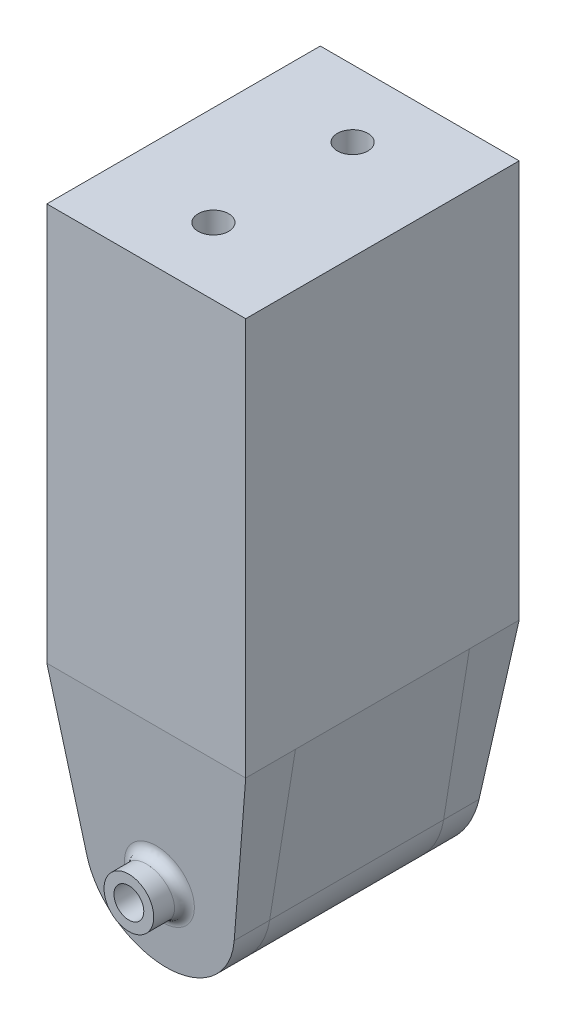
from build123d import *

# Parameters (mm, degrees)
CROQUIS1_W                          = 40
CROQUIS1_H                          = 55
SALIENTE_EXTRUIR1_DEPTH             = 80
CROQUIS2_R                          = 3.075
CORTAR_EXTRUIR2_DEPTH               = 87.926693254
SALIENTE_EXTRUIR2_REACH             = 88.927
SALIENTE_EXTRUIR2_DIRECTION_2_REACH = 88.927
CORTAR_EXTRUIR6_DEPTH               = 87.926693254
CORTAR_EXTRUIR6_DEPTH_BACK          = 87.926693254
CROQUIS6_R                          = 3
CORTAR_EXTRUIR10_DEPTH              = 10
CROQUIS11_R                         = 3
SALIENTE_EXTRUIR3_DEPTH             = 10
CORTAR_EXTRUIR11_DEPTH              = 87.926693254
CORTAR_EXTRUIR11_DEPTH_BACK         = 87.926693254
CORTAR_EXTRUIR15_START              = -10
CORTAR_EXTRUIR15_DEPTH              = 10
CROQUIS17_R                         = 3
SALIENTE_EXTRUIR4_DEPTH             = 10
CORTAR_EXTRUIR16_DEPTH              = 87.926693254
CORTAR_EXTRUIR16_DEPTH_BACK         = 87.926693254
CROQUIS21_R                         = 5
CROQUIS21_R_2                       = 3
SALIENTE_EXTRUIR5_DEPTH             = 3.5
SALIENTE_EXTRUIR5_DIRECTION_2_REACH = 101.121
REDONDEO1_R                         = 2
CROQUIS22_R                         = 5
CROQUIS22_R_2                       = 3
SALIENTE_EXTRUIR6_DEPTH             = 3.5
SALIENTE_EXTRUIR6_DIRECTION_2_REACH = 103.105


with BuildPart() as part:
    # Croquis1 → Saliente-Extruir1 (new body)
    with BuildSketch(Plane(origin=(0, 0, 0), x_dir=(1, 0, 0), z_dir=(0, 1, 0))):
        Rectangle(CROQUIS1_W, CROQUIS1_H)
    extrude(amount=SALIENTE_EXTRUIR1_DEPTH)

    # Croquis2 → Cortar-Extruir2 (cut, through all)
    with BuildSketch(Plane(origin=(0, 0, 0), x_dir=(1, 0, 0), z_dir=(0, 1, 0))):
        with Locations(Location((0, 14, 0), (0, 0, 270))):
            Circle(CROQUIS2_R)
        with Locations(Location((0, -14, 0), (0, 0, 90))):
            Circle(CROQUIS2_R)
    extrude(amount=CORTAR_EXTRUIR2_DEPTH, mode=Mode.SUBTRACT)

    # Saliente-Extruir2: up to this face of the body (flat: up to its plane)
    saliente_extruir2_end = Plane(part.part.faces().sort_by_distance((0, 40, 27.5))[0])
    # Croquis5 → Saliente-Extruir2 (add, up to the picked face)
    with BuildSketch(Plane.XY, mode=Mode.PRIVATE) as saliente_extruir2_sk1:
        with BuildLine():
            Line((-20, 0), (-14.810951292, -32.373967528))
            ThreePointArc((-14.810951292, -32.373967528), (0, -45), (14.810951292, -32.373967528))
            Line((14.810951292, -32.373967528), (20, 0))
            Line((20, 0), (-20, 0))
        make_face()
    saliente_extruir2_tool1 = split(extrude(saliente_extruir2_sk1.sketch, amount=SALIENTE_EXTRUIR2_REACH, mode=Mode.PRIVATE), bisect_by=saliente_extruir2_end, keep=Keep.BOTH, mode=Mode.PRIVATE)
    add(saliente_extruir2_tool1.solids().sort_by(Axis((0, -19.849245, 0), (0, 0, 1)))[0])

    # Saliente-Extruir2 direction 2: up to this face of the body (flat: up to its plane)
    saliente_extruir2_direction_2_end = Plane(part.part.faces().sort_by_distance((0, 40, -27.5))[0])
    # Croquis5 → Saliente-Extruir2 direction 2 (add, up to the picked face)
    with BuildSketch(Plane.XY, mode=Mode.PRIVATE) as saliente_extruir2_direction_2_sk1:
        with BuildLine():
            Line((-20, 0), (-14.810951292, -32.373967528))
            ThreePointArc((-14.810951292, -32.373967528), (0, -45), (14.810951292, -32.373967528))
            Line((14.810951292, -32.373967528), (20, 0))
            Line((20, 0), (-20, 0))
        make_face()
    saliente_extruir2_direction_2_tool1 = split(extrude(saliente_extruir2_direction_2_sk1.sketch, amount=-SALIENTE_EXTRUIR2_DIRECTION_2_REACH, mode=Mode.PRIVATE), bisect_by=saliente_extruir2_direction_2_end, keep=Keep.BOTH, mode=Mode.PRIVATE)
    add(saliente_extruir2_direction_2_tool1.solids().sort_by(Axis((0, -19.849245, 0), (0, 0, -1)))[0])

    # Croquis6 → Cortar-Extruir6 (cut, two sides: drawn at the far end of the back side and taken through both)
    with BuildSketch(Plane.XY.offset(-CORTAR_EXTRUIR6_DEPTH_BACK)):
        with Locations((0, -30)):
            Circle(CROQUIS6_R)
    extrude(amount=CORTAR_EXTRUIR6_DEPTH + CORTAR_EXTRUIR6_DEPTH_BACK, mode=Mode.SUBTRACT)

    # Croquis10 → Cortar-Extruir10 (cut)
    with BuildSketch(Plane(origin=(0, 0, -27.5), x_dir=(-1, 0, 0), z_dir=(0, 0, -1))):
        with BuildLine():
            Line((14.810951292, -32.373967528), (20, 0))
            Line((20, 0), (-20, 0))
            Line((-20, 0), (-14.810951292, -32.373967528))
            ThreePointArc((-14.810951292, -32.373967528), (0, -45), (14.810951292, -32.373967528))
        make_face()
    extrude(amount=-CORTAR_EXTRUIR10_DEPTH, mode=Mode.SUBTRACT)

    # Croquis16 → Cortar-Extruir15 (cut)
    with BuildSketch(Plane.XY.offset(27.5).offset(CORTAR_EXTRUIR15_START)):
        with BuildLine():
            Line((-20, 0), (20, 0))
            Line((20, 0), (14.810951292, -32.373967528))
            ThreePointArc((14.810951292, -32.373967528), (0, -45), (-14.810951292, -32.373967528))
            Line((-14.810951292, -32.373967528), (-20, 0))
        make_face()
    extrude(amount=CORTAR_EXTRUIR15_DEPTH, mode=Mode.SUBTRACT)


with BuildPart() as body_2:
    # Croquis11 → Saliente-Extruir3 (new body)
    with BuildSketch(Plane(origin=(0, 0, -17.5), x_dir=(-1, 0, 0), z_dir=(0, 0, -1))):
        with BuildLine():
            Line((20, 0), (-20, 0))
            Line((-20, 0), (-14.810951292, -32.373967528))
            ThreePointArc((-14.810951292, -32.373967528), (0, -45), (14.810951292, -32.373967528))
            Line((14.810951292, -32.373967528), (20, 0))
        make_face()
        with Locations((0, -30)):
            Circle(CROQUIS11_R, mode=Mode.SUBTRACT)
    extrude(amount=SALIENTE_EXTRUIR3_DEPTH)

    # Croquis12 → Cortar-Extruir11 (cut, two sides: drawn at the far end of the back side and taken through both)
    with BuildSketch(Plane(origin=(0, 0, 0), x_dir=(0, 0, -1), z_dir=(1, 0, 0)).offset(-CORTAR_EXTRUIR11_DEPTH_BACK)):
        with BuildLine():
            Line((27.5, 0), (23.5, -45))
            add(Edge.make_bspline(
                [(23.5, -45), (53.895048744, -65.691423054), (27.5, 0)],
                knots=[0, 0, 0, 1, 1, 1], degree=2))
        make_face()
    extrude(amount=CORTAR_EXTRUIR11_DEPTH + CORTAR_EXTRUIR11_DEPTH_BACK, mode=Mode.SUBTRACT)

    # Croquis22 → Saliente-Extruir6 (add)
    with BuildSketch(Plane(origin=(0, 0, -27.5), x_dir=(-1, 0, 0), z_dir=(0, 0, -1))):
        with Locations(Location((0, -30, 0), (0, 0, 180))):
            Circle(CROQUIS22_R)
        with Locations(Location((0, -30, 0), (0, 0, 180))):
            Circle(CROQUIS22_R_2, mode=Mode.SUBTRACT)
    extrude(amount=SALIENTE_EXTRUIR6_DEPTH)

    # Saliente-Extruir6 direction 2: up to this face of the body (flat: up to its plane)
    saliente_extruir6_direction_2_end = Plane(body_2.part.faces().sort_by_distance((0, -19.641450964, -25.754093248))[0])
    # Croquis22 → Saliente-Extruir6 direction 2 (add, up to the picked face)
    with BuildSketch(Plane(origin=(0, 0, -27.5), x_dir=(-1, 0, 0), z_dir=(0, 0, -1)), mode=Mode.PRIVATE) as saliente_extruir6_direction_2_sk1:
        with Locations(Location((0, -30, 0), (0, 0, 180))):
            Circle(CROQUIS22_R)
        with Locations(Location((0, -30, 0), (0, 0, 180))):
            Circle(CROQUIS22_R_2, mode=Mode.SUBTRACT)
    saliente_extruir6_direction_2_tool1 = split(extrude(saliente_extruir6_direction_2_sk1.sketch, amount=-SALIENTE_EXTRUIR6_DIRECTION_2_REACH, mode=Mode.PRIVATE), bisect_by=saliente_extruir6_direction_2_end, keep=Keep.BOTH, mode=Mode.PRIVATE)
    add(saliente_extruir6_direction_2_tool1.solids().sort_by(Axis((-4.858579, -30, -27.5), (0, 0, 1)))[0])


with BuildPart() as body_3:
    # Croquis17 → Saliente-Extruir4 (new body)
    with BuildSketch(Plane.XY.offset(17.5)):
        with BuildLine():
            Line((14.810951292, -32.373967528), (20, 0))
            Line((20, 0), (-20, 0))
            Line((-20, 0), (-14.810951292, -32.373967528))
            ThreePointArc((-14.810951292, -32.373967528), (0, -45), (14.810951292, -32.373967528))
        make_face()
        with Locations(Location((0, -30, 0), (0, 0, 180))):
            Circle(CROQUIS17_R, mode=Mode.SUBTRACT)
    extrude(amount=SALIENTE_EXTRUIR4_DEPTH)

    # Croquis18 → Cortar-Extruir16 (cut, two sides: drawn at the far end of the back side and taken through both)
    with BuildSketch(Plane(origin=(0, 0, 0), x_dir=(0, 0, -1), z_dir=(1, 0, 0)).offset(-CORTAR_EXTRUIR16_DEPTH_BACK)):
        with BuildLine():
            Line((-27.5, 0), (-23.5, -45))
            add(Edge.make_bspline(
                [(-23.5, -45), (-50.99373039, -70.964066745), (-27.5, 0)],
                knots=[0, 0, 0, 1, 1, 1], degree=2))
        make_face()
    extrude(amount=CORTAR_EXTRUIR16_DEPTH + CORTAR_EXTRUIR16_DEPTH_BACK, mode=Mode.SUBTRACT)

    # Croquis21 → Saliente-Extruir5 (add)
    with BuildSketch(Plane.XY.offset(27.5)):
        with Locations((0, -30)):
            Circle(CROQUIS21_R)
        with Locations((0, -30)):
            Circle(CROQUIS21_R_2, mode=Mode.SUBTRACT)
    extrude(amount=SALIENTE_EXTRUIR5_DEPTH)

    # Saliente-Extruir5 direction 2: up to this face of the body (flat: up to its plane)
    saliente_extruir5_direction_2_end = Plane(body_3.part.faces().sort_by_distance((0, -19.641450964, 25.754093248))[0])
    # Croquis21 → Saliente-Extruir5 direction 2 (add, up to the picked face)
    with BuildSketch(Plane.XY.offset(27.5), mode=Mode.PRIVATE) as saliente_extruir5_direction_2_sk1:
        with Locations((0, -30)):
            Circle(CROQUIS21_R)
        with Locations((0, -30)):
            Circle(CROQUIS21_R_2, mode=Mode.SUBTRACT)
    saliente_extruir5_direction_2_tool1 = split(extrude(saliente_extruir5_direction_2_sk1.sketch, amount=-SALIENTE_EXTRUIR5_DIRECTION_2_REACH, mode=Mode.PRIVATE), bisect_by=saliente_extruir5_direction_2_end, keep=Keep.BOTH, mode=Mode.PRIVATE)
    add(saliente_extruir5_direction_2_tool1.solids().sort_by(Axis((-4.858579, -30, 27.5), (0, 0, -1)))[0])

    # Redondeo1
    redondeo1_edges = [body_3.edges().sort_by_distance(p)[0] for p in [
        (-5, -30.00000001, 24.833333332),
    ]]
    fillet(redondeo1_edges, radius=REDONDEO1_R)


solid = Compound([part.part, body_2.part, body_3.part])
